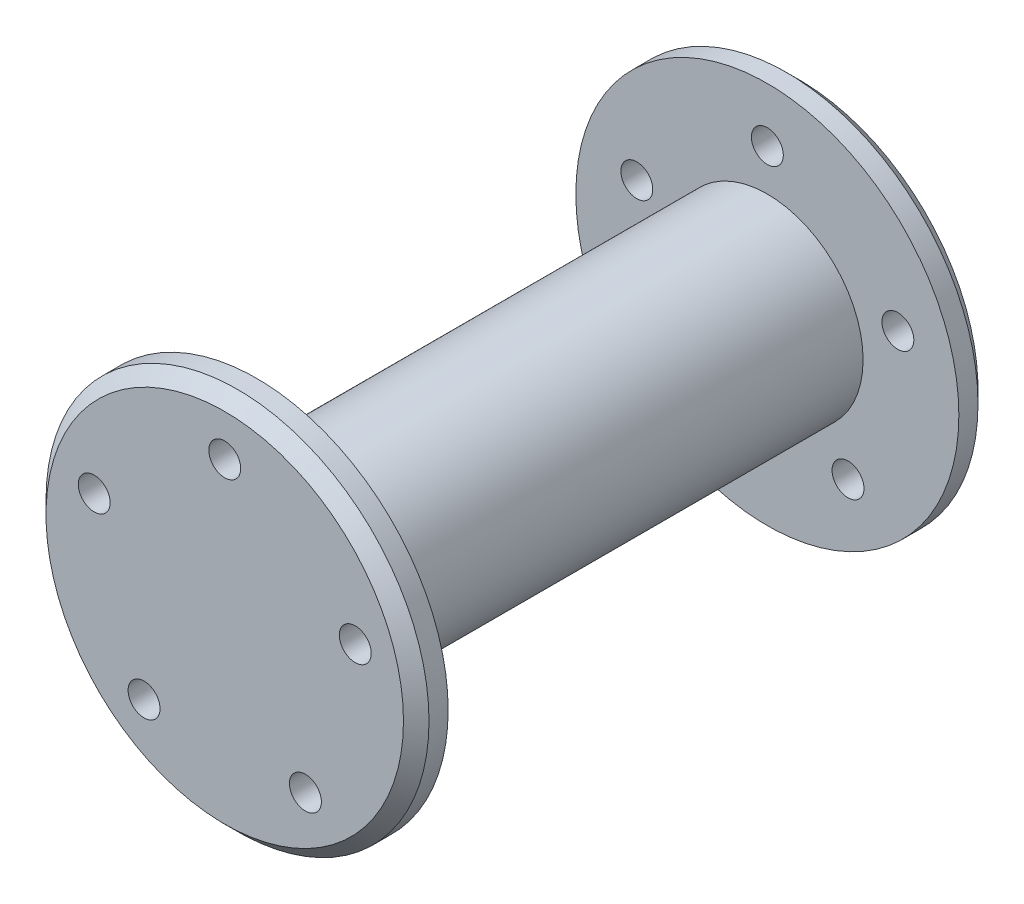
from build123d import *

# Parameters (mm, degrees)
SKETCH1_R                = 15
BOSS_EXTRUDE1_DEPTH      = 80
SKETCH2_R                = 30
BOSS_EXTRUDE2_DEPTH      = 5
CHAMFER1_SIZE            = 2
SKETCH3_R                = 2.5
CUT_EXTRUDE1_DEPTH       = 96
CIRPATTERN5_COUNT        = 5
MIRROR3_COPY_1_SKETCH_R  = 2.5
MIRROR3_COPY_1_DEPTH     = 96
MIRROR3_COPY_2_SKETCH_R  = 2.5
MIRROR3_COPY_2_DEPTH     = 96
MIRROR3_COPY_3_SKETCH_R  = 2.5
MIRROR3_COPY_3_DEPTH     = 96
MIRROR3_COPY_4_SKETCH_R  = 2.5
MIRROR3_COPY_4_DEPTH     = 96
MIRROR3_COPY_5_SKETCH_R  = 2.5
MIRROR3_COPY_5_DEPTH     = 96
CHAMFER1_OF_MIRROR3_SIZE = 2


with BuildPart() as part:
    # Sketch1 → Boss-Extrude1 (new body)
    with BuildSketch(Plane.XY):
        Circle(SKETCH1_R)
    extrude(amount=BOSS_EXTRUDE1_DEPTH)

    # Sketch2 → Boss-Extrude2 (add)
    with BuildSketch(Plane(origin=(0, 0, 0), x_dir=(-1, 0, 0), z_dir=(0, 0, -1))):
        Circle(SKETCH2_R)
    boss_extrude2 = extrude(amount=BOSS_EXTRUDE2_DEPTH)

    # Chamfer1
    chamfer1_edges = [part.edges().sort_by_distance(p)[0] for p in [
        (30, 0, -5),
    ]]
    chamfer(chamfer1_edges, length=CHAMFER1_SIZE)

    # Sketch3 → Cut-Extrude1 (cut, through all)
    with BuildSketch(Plane(origin=(0, 0, -5), x_dir=(-1, 0, 0), z_dir=(0, 0, -1))):
        with Locations((0, 21.5)):
            Circle(SKETCH3_R)
    cut_extrude1 = extrude(amount=-CUT_EXTRUDE1_DEPTH, mode=Mode.SUBTRACT)

    # CirPattern5: Cut-Extrude1 ×5 about axis
    cirpattern5_axis = Axis((0, 0, -5), (0, 0, 1))
    for i in range(1, CIRPATTERN5_COUNT):
        add(cut_extrude1.rotate(cirpattern5_axis, i * 360 / CIRPATTERN5_COUNT), mode=Mode.SUBTRACT)

    # Mirror3: Boss-Extrude2 across plane
    add(boss_extrude2.mirror(Plane.XY.offset(40)))

    # Mirror3 copy 1 sketch → Mirror3 copy 1 (cut, through all)
    with BuildSketch(Plane(origin=(0, 0, 85), x_dir=(-0.30901699437494745, -0.9510565162951535, 0), z_dir=(0, 0, 1))):
        with Locations((0, -21.5)):
            Circle(MIRROR3_COPY_1_SKETCH_R)
    extrude(amount=-MIRROR3_COPY_1_DEPTH, mode=Mode.SUBTRACT)

    # Mirror3 copy 2 sketch → Mirror3 copy 2 (cut, through all)
    with BuildSketch(Plane(origin=(0, 0, 85), x_dir=(0.8090169943749473, -0.5877852522924732, 0), z_dir=(0, 0, 1))):
        with Locations((0, -21.5)):
            Circle(MIRROR3_COPY_2_SKETCH_R)
    extrude(amount=-MIRROR3_COPY_2_DEPTH, mode=Mode.SUBTRACT)

    # Mirror3 copy 3 sketch → Mirror3 copy 3 (cut, through all)
    with BuildSketch(Plane(origin=(0, 0, 85), x_dir=(0.8090169943749476, 0.587785252292473, 0), z_dir=(0, 0, 1))):
        with Locations((0, -21.5)):
            Circle(MIRROR3_COPY_3_SKETCH_R)
    extrude(amount=-MIRROR3_COPY_3_DEPTH, mode=Mode.SUBTRACT)

    # Mirror3 copy 4 sketch → Mirror3 copy 4 (cut, through all)
    with BuildSketch(Plane(origin=(0, 0, 85), x_dir=(-0.30901699437494723, 0.9510565162951536, 0), z_dir=(0, 0, 1))):
        with Locations((0, -21.5)):
            Circle(MIRROR3_COPY_4_SKETCH_R)
    extrude(amount=-MIRROR3_COPY_4_DEPTH, mode=Mode.SUBTRACT)

    # Mirror3 copy 5 sketch → Mirror3 copy 5 (cut, through all)
    with BuildSketch(Plane(origin=(0, 0, 85), x_dir=(-1, 0, 0), z_dir=(0, 0, 1))):
        with Locations((0, -21.5)):
            Circle(MIRROR3_COPY_5_SKETCH_R)
    extrude(amount=-MIRROR3_COPY_5_DEPTH, mode=Mode.SUBTRACT)

    # Chamfer1 of Mirror3
    chamfer1_of_mirror3_edges = [part.edges().sort_by_distance(p)[0] for p in [
        (30, 0, 85),
    ]]
    chamfer(chamfer1_of_mirror3_edges, length=CHAMFER1_OF_MIRROR3_SIZE)


solid = part.part
